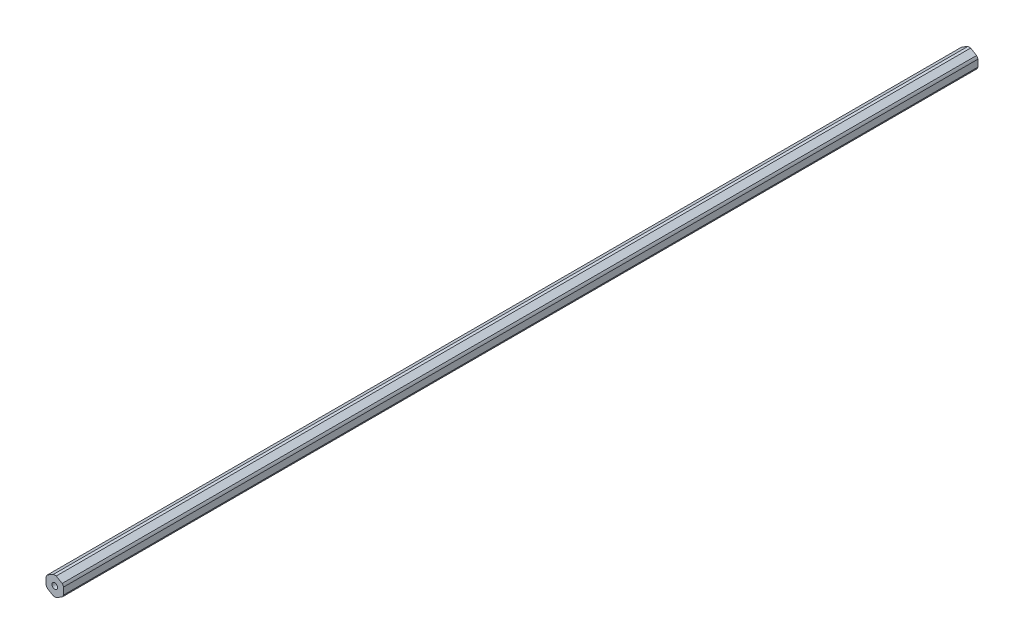
from build123d import *

# Parameters (mm, degrees)
BOSS_EXTRUDE1_DEPTH        = 660.4
F_10_32_TAPPED_HOLE1_D     = 4.0386
F_10_32_TAPPED_HOLE1_DEPTH = 12.02944
F_10_32_TAPPED_HOLE1_TIP   = 1.213317848
F_10_32_TAPPED_HOLE2_D     = 4.0386
F_10_32_TAPPED_HOLE2_DEPTH = 12.02944
F_10_32_TAPPED_HOLE2_TIP   = 1.213317848


with BuildPart() as part:
    # Sketch1 → Boss-Extrude1 (new body)
    with BuildSketch(Plane.XY):
        with BuildLine():
            ThreePointArc((6.35, 2.48767683), (5.906206651, 3.40995), (5.329391331, 4.255422899))
            Line((5.329391331, 4.255422899), (1.020608669, 6.743099729))
            ThreePointArc((1.020608669, 6.743099729), (0, 6.8199), (-1.020608669, 6.743099729))
            Line((-1.020608669, 6.743099729), (-5.329391331, 4.255422899))
            ThreePointArc((-5.329391331, 4.255422899), (-5.906206651, 3.40995), (-6.35, 2.48767683))
            Line((-6.35, 2.48767683), (-6.35, -2.48767683))
            ThreePointArc((-6.35, -2.48767683), (-5.906206651, -3.40995), (-5.329391331, -4.255422899))
            Line((-5.329391331, -4.255422899), (-1.020608669, -6.743099729))
            ThreePointArc((-1.020608669, -6.743099729), (0, -6.8199), (1.020608669, -6.743099729))
            Line((1.020608669, -6.743099729), (5.329391331, -4.255422899))
            ThreePointArc((5.329391331, -4.255422899), (5.906206651, -3.40995), (6.35, -2.48767683))
            Line((6.35, -2.48767683), (6.35, 2.48767683))
        make_face()
    extrude(amount=BOSS_EXTRUDE1_DEPTH)

    # #10-32 Tapped Hole1
    with Locations(Plane.XY.offset(660.4)):
        with Locations((0, 0)):
            Hole(F_10_32_TAPPED_HOLE1_D / 2, depth=F_10_32_TAPPED_HOLE1_DEPTH)
            with Locations((0, 0, -(F_10_32_TAPPED_HOLE1_DEPTH + F_10_32_TAPPED_HOLE1_TIP / 2))):  # 118° drill point
                Cone(0, F_10_32_TAPPED_HOLE1_D / 2, F_10_32_TAPPED_HOLE1_TIP, mode=Mode.SUBTRACT)

    # #10-32 Tapped Hole2
    with Locations(Plane(origin=(0, 0, 0), x_dir=(-1, 0, 0), z_dir=(0, 0, -1))):
        with Locations((0, 0)):
            Hole(F_10_32_TAPPED_HOLE2_D / 2, depth=F_10_32_TAPPED_HOLE2_DEPTH)
            with Locations((0, 0, -(F_10_32_TAPPED_HOLE2_DEPTH + F_10_32_TAPPED_HOLE2_TIP / 2))):  # 118° drill point
                Cone(0, F_10_32_TAPPED_HOLE2_D / 2, F_10_32_TAPPED_HOLE2_TIP, mode=Mode.SUBTRACT)


solid = part.part
